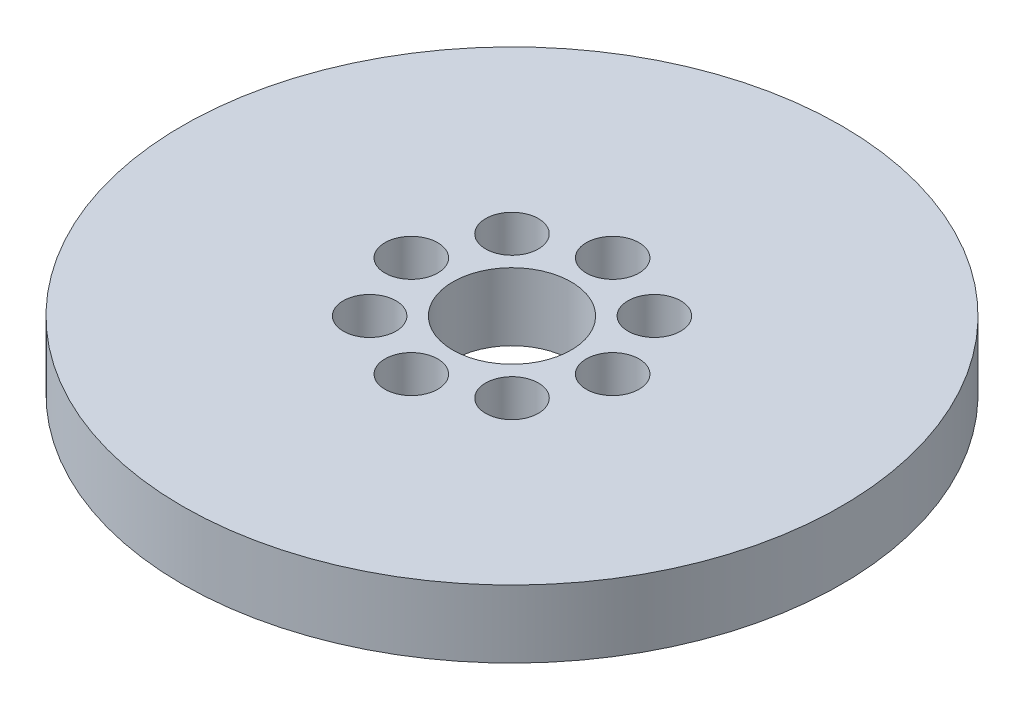
from build123d import *

# Parameters (mm, degrees)
SKETCH1_R           = 97.5
BOSS_EXTRUDE1_DEPTH = 20
SKETCH2_R           = 17.5
CUT_EXTRUDE1_DEPTH  = 140.328747931
SKETCH3_R           = 7.802226785
CUT_EXTRUDE2_DEPTH  = 15.658832012
CIRPATTERN1_COUNT   = 8


with BuildPart() as part:
    # Sketch1 → Boss-Extrude1 (new body)
    with BuildSketch(Plane(origin=(0, 0, 0), x_dir=(1, 0, 0), z_dir=(0, 1, 0))):
        Circle(SKETCH1_R)
    extrude(amount=BOSS_EXTRUDE1_DEPTH)

    # Sketch2 → Cut-Extrude1 (cut, through all)
    with BuildSketch(Plane(origin=(0, 0, 0), x_dir=(1, 0, 0), z_dir=(0, 1, 0))):
        Circle(SKETCH2_R)
    extrude(amount=CUT_EXTRUDE1_DEPTH, mode=Mode.SUBTRACT)

    # Sketch3 → Cut-Extrude2 (cut)
    with BuildSketch(Plane(origin=(0, 20, 0), x_dir=(1, 0, 0), z_dir=(0, 1, 0))):
        with Locations((-29.783964546, 0)):
            Circle(SKETCH3_R)
    cut_extrude2 = extrude(amount=-CUT_EXTRUDE2_DEPTH, mode=Mode.SUBTRACT)

    # CirPattern1: Cut-Extrude2 ×8 about axis
    cirpattern1_axis = Axis((0, 0, 0), (0, 1, 0))
    for i in range(1, CIRPATTERN1_COUNT):
        add(cut_extrude2.rotate(cirpattern1_axis, i * 360 / CIRPATTERN1_COUNT), mode=Mode.SUBTRACT)


solid = part.part
